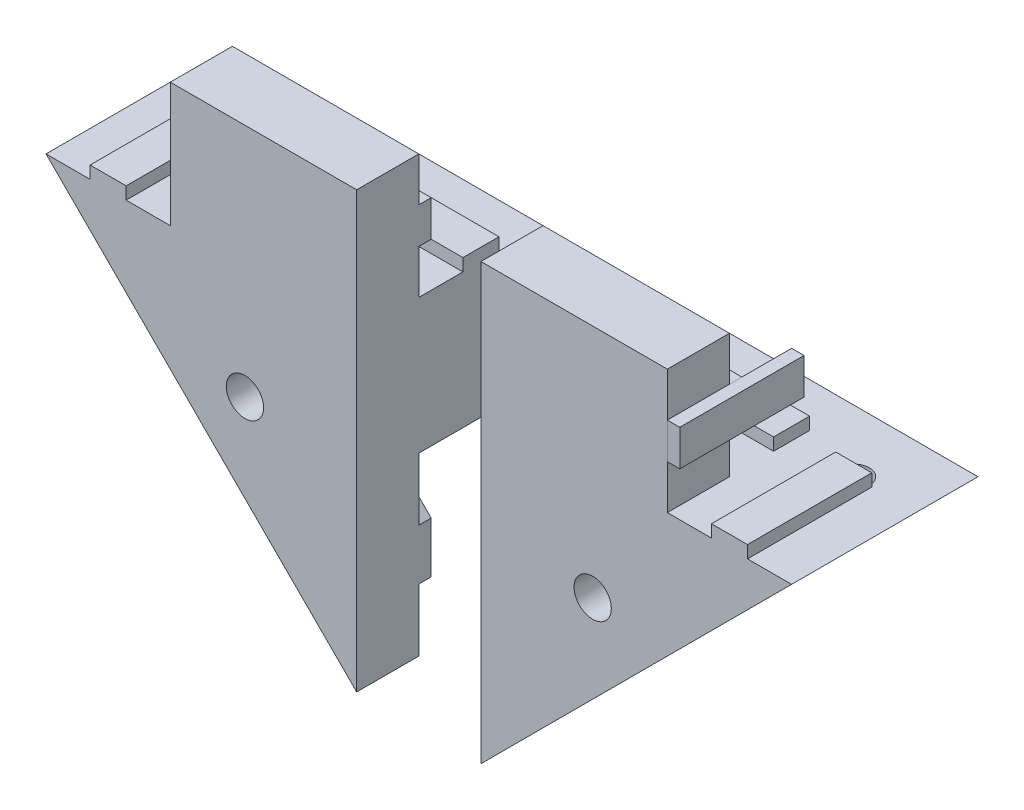
from build123d import *

# Parameters (mm, degrees)
MAIN_DEPTH          = 15
SKETCH4_W           = 15
SKETCH4_H           = 10
CUT_EXTRUDE2_DEPTH  = 10
SKETCH2_W           = 15
SKETCH2_H           = 2.9
BOSS_EXTRUDE3_DEPTH = 1
SKETCH5_W           = 2.9
SKETCH5_H           = 12.715728752
BOSS_EXTRUDE4_DEPTH = 1
SKETCH6_R           = 1.5
BOSS_EXTRUDE5_DEPTH = 5
BOSS_EXTRUDE6_DEPTH = 1
SKETCH8_W           = 2.9
SKETCH8_H           = 10
BOSS_EXTRUDE7_DEPTH = 1
SKETCH9_W           = 1
SKETCH9_H           = 2.9
BOSS_EXTRUDE8_DEPTH = 10
SKETCH11_R          = 1.25
CUT_EXTRUDE4_DEPTH  = 39.405728739
SKETCH12_R          = 1.5
CUT_EXTRUDE5_DEPTH  = 39.405728739
SKETCH13_W          = 15
SKETCH13_H          = 2.9
BOSS_EXTRUDE9_DEPTH = 1


with BuildPart() as part:
    # Sketch1 → Main (new body)
    with BuildSketch(Plane.XY):
        Polygon((0, 0), (-10, 0), (-10, 10), (-25, 10), (-25, -10.857864376), (-16.008621971, -1.866486348), (-8.937554159, -8.937554159), align=None)
    extrude(amount=MAIN_DEPTH)

    # Sketch4 → Cut-Extrude2 (cut)
    with BuildSketch(Plane(origin=(0, 0, 0), x_dir=(-1, 0, 0), z_dir=(0, 0, -1))):
        with Locations((17.5, 5)):
            Rectangle(SKETCH4_W, SKETCH4_H)
    extrude(amount=-CUT_EXTRUDE2_DEPTH, mode=Mode.SUBTRACT)

    # Sketch2 → Boss-Extrude3 (add)
    with BuildSketch(Plane(origin=(0, 0, 10), x_dir=(-1, 0, 0), z_dir=(0, 0, -1))):
        with Locations((17.5, 5)):
            Rectangle(SKETCH2_W, SKETCH2_H)
    extrude(amount=BOSS_EXTRUDE3_DEPTH)

    # Sketch5 → Boss-Extrude4 (add)
    with BuildSketch(Plane(origin=(-7.071067812, 7.071067812, 0), x_dir=(0, 0, -1), z_dir=(0.7071067811865573, -0.7071067811865378, 0))):
        with Locations((-5, -18.997474683)):
            Rectangle(SKETCH5_W, SKETCH5_H)
    extrude(amount=BOSS_EXTRUDE4_DEPTH)

    # Sketch6 → Boss-Extrude5 (add)
    with BuildSketch(Plane.XY.offset(10)):
        Polygon((-25, -10.857864376), (-16.008621971, -1.866486348), (-8.937554159, -8.937554159), (-25, -25), align=None)
        with Locations((-16.008621971, -8.937554159)):
            Circle(SKETCH6_R, mode=Mode.SUBTRACT)
    extrude(amount=BOSS_EXTRUDE5_DEPTH)

    # Sketch7 → Boss-Extrude6 (add)
    with BuildSketch(Plane(origin=(0, 0, 10), x_dir=(-1, 0, 0), z_dir=(0, 0, -1))):
        Polygon((13.498392898, -4.376715421), (25, -15.878322523), (25, -19.979541854), (11.447783233, -6.427325086), align=None)
    extrude(amount=BOSS_EXTRUDE6_DEPTH)

    # Sketch8 → Boss-Extrude7 (add)
    with BuildSketch(Plane(origin=(0, 0, 0), x_dir=(1, 0, 0), z_dir=(0, 1, 0))):
        with Locations((-5, -10)):
            Rectangle(SKETCH8_W, SKETCH8_H)
    extrude(amount=BOSS_EXTRUDE7_DEPTH)

    # Sketch11 → Cut-Extrude4 (cut, through all)
    with BuildSketch(Plane(origin=(0, 0, 0), x_dir=(1, 0, 0), z_dir=(0, 1, 0))):
        with Locations((-5, -5)):
            Circle(SKETCH11_R)
    extrude(amount=-CUT_EXTRUDE4_DEPTH, mode=Mode.SUBTRACT)

    # Sketch12 → Cut-Extrude5 (cut, through all)
    with BuildSketch(Plane.XY.offset(15)):
        with Locations((-16.008621971, -8.937554159)):
            Circle(SKETCH12_R)
    extrude(amount=-CUT_EXTRUDE5_DEPTH, mode=Mode.SUBTRACT)

    # Sketch13 → Boss-Extrude9 (add)
    with BuildSketch(Plane(origin=(0, 0, 0), x_dir=(1, 0, 0), z_dir=(0, 1, 0))):
        with Locations((-17.5, -5)):
            Rectangle(SKETCH13_W, SKETCH13_H)
    extrude(amount=BOSS_EXTRUDE9_DEPTH)


with BuildPart() as body_2:
    # Sketch9 → Boss-Extrude8 (new body)
    with BuildSketch(Plane.XY.offset(15)):
        with Locations((-9.5, 5)):
            Rectangle(SKETCH9_W, SKETCH9_H)
    extrude(amount=-BOSS_EXTRUDE8_DEPTH)


with BuildPart() as body_3:
    # Mirror1: mirrored copy
    add(part.part.mirror(Plane.ZY.offset(30)))


solid = Compound([part.part, body_2.part, body_3.part])
